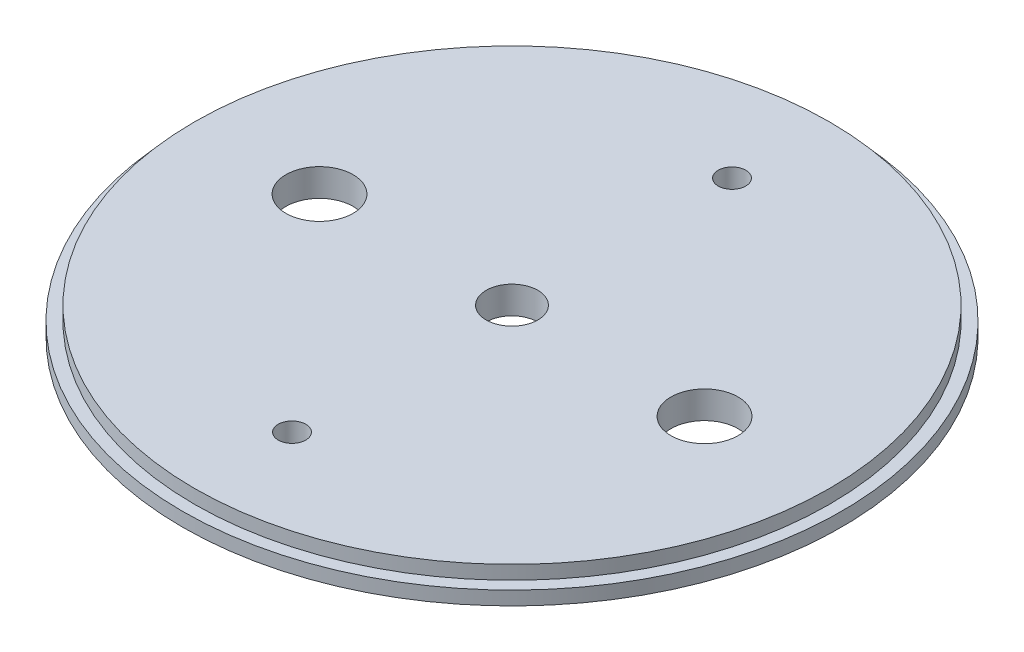
from build123d import *

# Parameters (mm, degrees)
SKETCH1_R                   = 76.0984
BOSS_EXTRUDE1_DEPTH         = 3.175
SKETCH1_3_R                 = 73.3171
BOSS_EXTRUDE2_DEPTH         = 6.35
F_1_4_0_25_DIAMETER_HOLE1_D = 6.35
M18X2_5_TAPPED_HOLE1_D      = 15.5
SKETCH3_3_R                 = 5.953125
CUT_EXTRUDE2_DEPTH          = 108.806565037


with BuildPart() as part:
    # Sketch1 → Boss-Extrude1 (new body)
    with BuildSketch(Plane(origin=(0, 0, 0), x_dir=(1, 0, 0), z_dir=(0, 1, 0))):
        Circle(SKETCH1_R)
    extrude(amount=BOSS_EXTRUDE1_DEPTH)

    # Sketch1<3> → Boss-Extrude2 (add)
    with BuildSketch(Plane(origin=(0, 0, 0), x_dir=(1, 0, 0), z_dir=(0, 1, 0))):
        Circle(SKETCH1_3_R)
    extrude(amount=BOSS_EXTRUDE2_DEPTH)

    # 1/4 (0.25) Diameter Hole1 (through all)
    with Locations(Plane(origin=(0, 0, 0), x_dir=(-1, 0, 0), z_dir=(0, -1, 0))):
        with Locations((0, 50.8), (0, -50.8)):
            Hole(F_1_4_0_25_DIAMETER_HOLE1_D / 2)

    # M18x2.5 Tapped Hole1 (through all)
    with Locations(Plane(origin=(0, 0, 0), x_dir=(-1, 0, 0), z_dir=(0, -1, 0))):
        with Locations((44.45, 0), (-44.45, 0)):
            Hole(M18X2_5_TAPPED_HOLE1_D / 2)

    # Sketch3<3> → Cut-Extrude2 (cut, through all)
    with BuildSketch(Plane.XZ):
        Circle(SKETCH3_3_R)
    extrude(amount=-CUT_EXTRUDE2_DEPTH, mode=Mode.SUBTRACT)


solid = part.part
